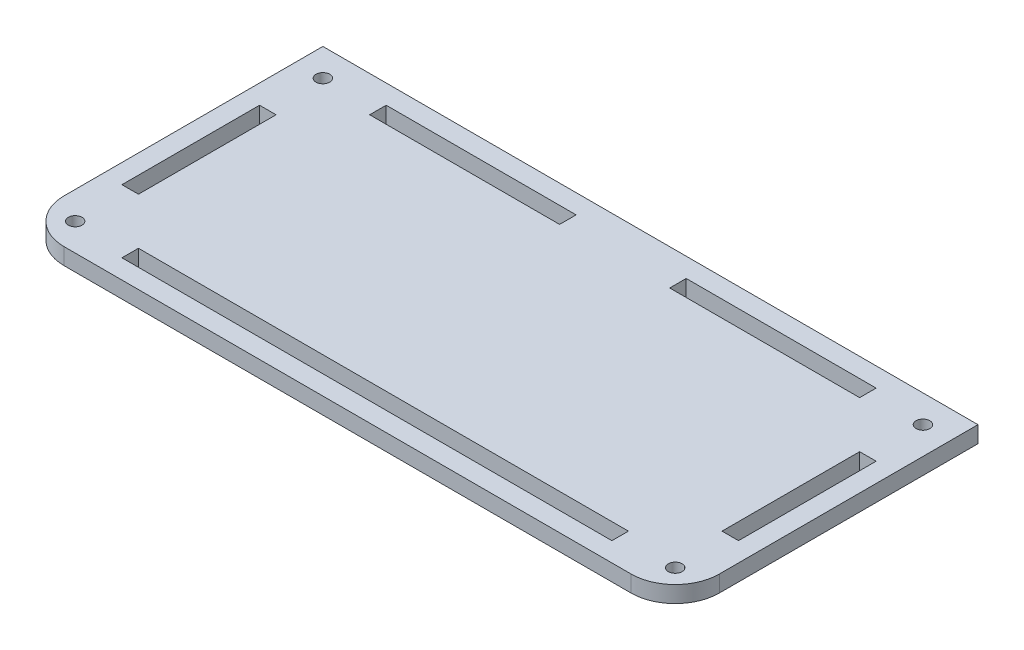
from build123d import *

# Parameters (mm, degrees)
SCHIZZO1_W                   = 119
SCHIZZO1_H                   = 55
ESTRUSIONE_ESTRUSIONE1_DEPTH = 3
FORO_FILETTATO_M3X0_5_1_D    = 2.5
SCHIZZO4_W                   = 89
SCHIZZO4_H                   = 3
SCHIZZO4_W_2                 = 3
SCHIZZO4_H_2                 = 25
TAGLIO_ESTRUSIONE1_DEPTH     = 66.616308948
RACCORDO1_R                  = 8
SCHIZZO5_W                   = 34.5
SCHIZZO5_H                   = 3
TAGLIO_ESTRUSIONE2_DEPTH     = 10


with BuildPart() as part:
    # Schizzo1 → Estrusione-Estrusione1 (new body)
    with BuildSketch(Plane(origin=(0, 0, 0), x_dir=(1, 0, 0), z_dir=(0, 1, 0))):
        Rectangle(SCHIZZO1_W, SCHIZZO1_H)
    extrude(amount=ESTRUSIONE_ESTRUSIONE1_DEPTH)

    # Foro filettato M3x0.5-1 (through all)
    with Locations(Plane(origin=(0, 3, 0), x_dir=(1, 0, 0), z_dir=(0, 1, 0))):
        with Locations((-54.5, -22.5), (54.5, -22.5), (54.5, 22.5), (-54.5, 22.5)):
            Hole(FORO_FILETTATO_M3X0_5_1_D / 2)

    # Schizzo4 → Taglio-Estrusione1 (cut, through all)
    with BuildSketch(Plane(origin=(0, 3, 0), x_dir=(1, 0, 0), z_dir=(0, 1, 0))):
        with Locations((0, -22.5)):
            Rectangle(SCHIZZO4_W, SCHIZZO4_H)
        with Locations((54.5, 0)):
            Rectangle(SCHIZZO4_W_2, SCHIZZO4_H_2)
        with Locations((-54.5, 0)):
            Rectangle(SCHIZZO4_W_2, SCHIZZO4_H_2)
    extrude(amount=-TAGLIO_ESTRUSIONE1_DEPTH, mode=Mode.SUBTRACT)

    # Raccordo1
    raccordo1_edges = [part.edges().sort_by_distance(p)[0] for p in [
        (-59.5, 1.5, 27.5),
        (59.5, 1.5, 27.5),
    ]]
    fillet(raccordo1_edges, radius=RACCORDO1_R)

    # Schizzo5 → Taglio-Estrusione2 (cut)
    with BuildSketch(Plane(origin=(0, 3, 0), x_dir=(1, 0, 0), z_dir=(0, 1, 0))):
        with Locations((27.25, 22.5)):
            Rectangle(SCHIZZO5_W, SCHIZZO5_H)
        with Locations((-27.25, 22.5)):
            Rectangle(SCHIZZO5_W, SCHIZZO5_H)
    extrude(amount=-TAGLIO_ESTRUSIONE2_DEPTH, mode=Mode.SUBTRACT)


solid = part.part
